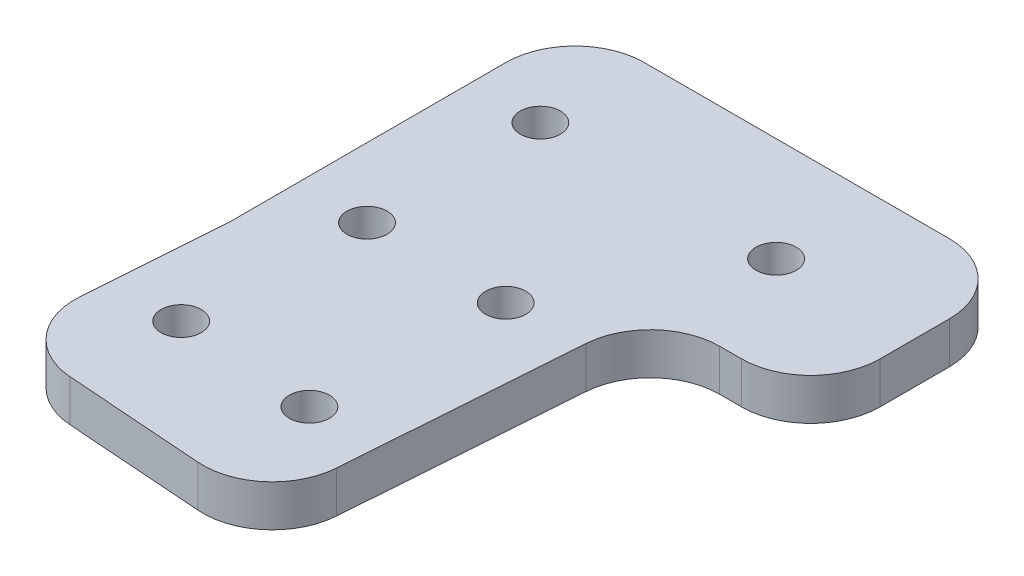
from build123d import *

# Parameters (mm, degrees)
SKETCH_1_R      = 1.45
EXTRUDE_1_DEPTH = 3
FILLET_1_R      = 5


with BuildPart() as part:
    # 草图1 → 凸台-拉伸1 (new body)
    with BuildSketch(Plane(origin=(0, 0, 0), x_dir=(1, 0, 0), z_dir=(0, 1, 0))):
        Polygon((0, 0), (0, -10), (-1.089249024, -24.960398944), (18.857949568, -26.412730977), (19.947198592, -11.452332033), (20.781029397, 0), (32, 0), (32, 15), (20.781029397, 15), (0, 15), align=None)
        with Locations(Location((5, 7.5, 0), (0, 0, 270))):
            Circle(SKETCH_1_R, mode=Mode.SUBTRACT)
        with Locations(Location((22, 7.5, 0), (0, 0, 270))):
            Circle(SKETCH_1_R, mode=Mode.SUBTRACT)
        with Locations(Location((4.442175136, -17.84328248, 0), (0, 0, 270))):
            Circle(SKETCH_1_R, mode=Mode.SUBTRACT)
        with Locations(Location((14.415774432, -18.569448496, 0), (0, 0, 270))):
            Circle(SKETCH_1_R, mode=Mode.SUBTRACT)
        with Locations(Location((5, -5, 0), (0, 0, 270))):
            Circle(SKETCH_1_R, mode=Mode.SUBTRACT)
        with Locations(Location((15, -5, 0), (0, 0, 270))):
            Circle(SKETCH_1_R, mode=Mode.SUBTRACT)
    extrude(amount=EXTRUDE_1_DEPTH)

    # 圆角1
    # the kernel refuses this fillet: 5 mm, written as the material it adds along each edge
    with BuildSketch(Plane(origin=(20.781029397, 0, 0), x_dir=(1, 0, 0), z_dir=(0, 1, 0))) as fillet_1_piece_1:
        with BuildLine():
            CenterArc((FILLET_1_R * 0.929838236779, -FILLET_1_R), FILLET_1_R, 90, 85.835709886)
            Line((-FILLET_1_R * 0.0675216928189, -FILLET_1_R * 0.927383398372), (0, 0))
            Line((0, 0), (FILLET_1_R * 0.929838236779, 0))
        make_face()
    extrude(amount=3)
    with BuildSketch(Plane(origin=(0, 0, 10), x_dir=(0, 0, -1), z_dir=(0, 1, 0))) as fillet_1_piece_2:
        with BuildLine():
            CenterArc((FILLET_1_R * 0.0363562923998, FILLET_1_R), FILLET_1_R, 265.835709886, 4.164290114)
            Line((-FILLET_1_R * 0.0362603092284, FILLET_1_R * 0.00264007040188), (0, 0))
            Line((0, 0), (FILLET_1_R * 0.0363562923998, 0))
        make_face()
    extrude(amount=3)
    # the kernel refuses this fillet: 5 mm, written as the material it takes off along each edge
    with BuildSketch(Plane(origin=(0, -12.5, -15), x_dir=(0, 0, 1), z_dir=(0, 1, 0)), Plane(origin=(32, -12.5, -15), x_dir=(-1, 0, 0), z_dir=(0, 1, 0))) as fillet_1_2_piece_1:
        with BuildLine():
            CenterArc((FILLET_1_R, FILLET_1_R), FILLET_1_R, 180, 90)
            Line((0, FILLET_1_R), (0, 0))
            Line((0, 0), (FILLET_1_R, 0))
        make_face()
    extrude(amount=28, mode=Mode.SUBTRACT)
    with BuildSketch(Plane(origin=(32, -12.5, 0), x_dir=(-1, 0, 0), z_dir=(0, 1, 0)), Plane(origin=(18.857949568, -12.5, 26.412730977), x_dir=(-0.9973599295981169, 0, -0.0726166016282719), z_dir=(0, 1, 0)), Plane(origin=(-1.089249024, -12.5, 24.960398944), x_dir=(0.07261660162819664, 0, -0.9973599295981225), z_dir=(0, 1, 0))) as fillet_1_2_piece_2:
        with BuildLine():
            CenterArc((FILLET_1_R, -FILLET_1_R), FILLET_1_R, 90, 90)
            Line((0, -FILLET_1_R), (0, 0))
            Line((0, 0), (FILLET_1_R, 0))
        make_face()
    extrude(amount=28, mode=Mode.SUBTRACT)


solid = part.part
